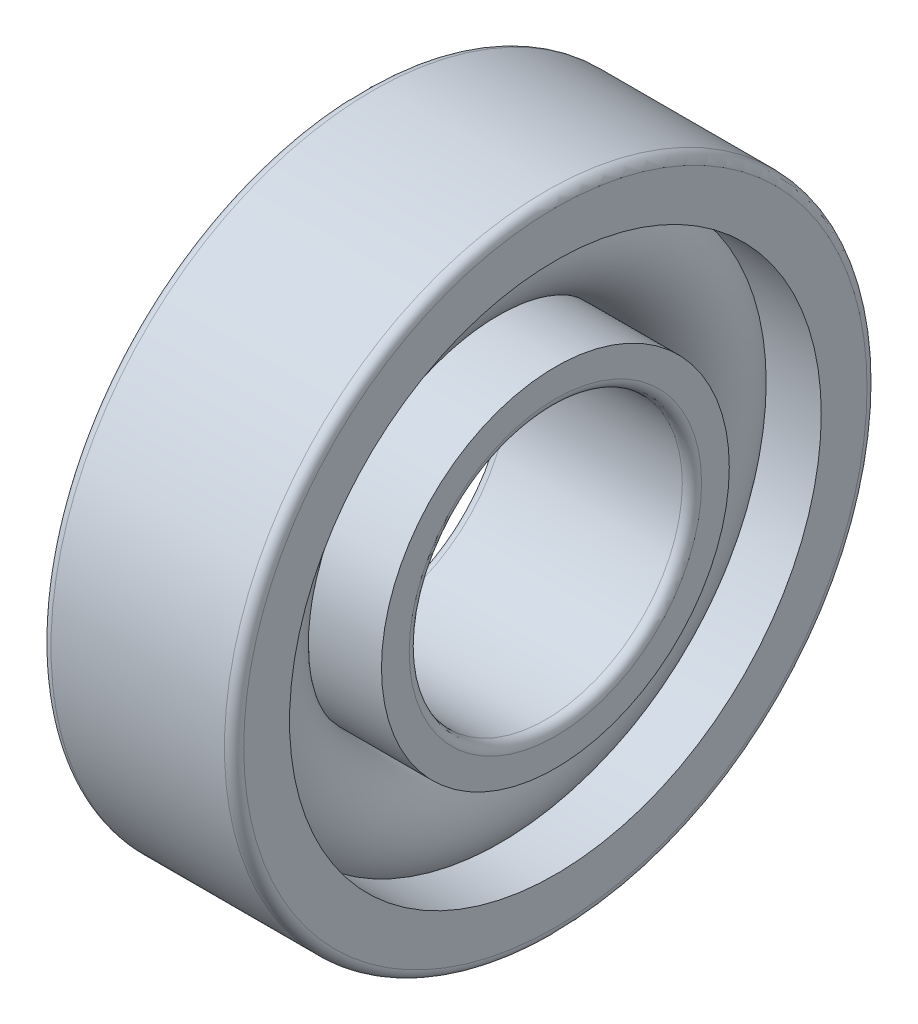
from build123d import *

# Parameters (mm, degrees)
CAGSPISKE_W     = 1.725
CAGSPISKE_H     = 1.15
CAGESPINE_ANGLE = 0.001
BALSIMSKE_R     = 3.45


with BuildPart() as part:
    # CagSpiSke → CageSpine (revolve)
    with BuildSketch(Plane.XY):
        with Locations((0, 14.25)):
            Rectangle(CAGSPISKE_W, CAGSPISKE_H)
    revolve(axis=Axis((-20.6375, 0, 0), (1, 0, 0)), revolution_arc=CAGESPINE_ANGLE)

    # BalSimSke → BallsSimplified (revolve)
    with BuildSketch(Plane.XY):
        with Locations((0, 14.25)):
            Circle(BALSIMSKE_R)
    revolve(axis=Axis((-10, 0, 0), (1, 0, 0)))

    # InnRacSke → InnerRace (revolve)
    with BuildSketch(Plane.XY):
        with BuildLine():
            Line((-2.537838647, 11.95), (-6, 11.95))
            Line((-6, 11.95), (-6, 9.1))
            ThreePointArc((-6, 9.1), (-5.824264069, 8.675735931), (-5.4, 8.5))
            Line((-5.4, 8.5), (5.4, 8.5))
            ThreePointArc((5.4, 8.5), (5.824264069, 8.675735931), (6, 9.1))
            Line((6, 9.1), (6, 10.825))
            Line((6, 10.825), (0, 10.825))
            ThreePointArc((0, 10.825), (-1.388006664, 11.11885604), (-2.537838647, 11.95))
        make_face()
    revolve(axis=Axis((-20.6375, 0, 0), (1, 0, 0)))

    # OutRacSke → OuterRace (revolve)
    with BuildSketch(Plane.XY):
        with BuildLine():
            Line((0, 17.675), (-6, 17.675))
            Line((-6, 17.675), (-6, 19.4))
            ThreePointArc((-6, 19.4), (-5.824264069, 19.824264069), (-5.4, 20))
            Line((-5.4, 20), (5.4, 20))
            ThreePointArc((5.4, 20), (5.824264069, 19.824264069), (6, 19.4))
            Line((6, 19.4), (6, 16.55))
            Line((6, 16.55), (2.537838647, 16.55))
            ThreePointArc((2.537838647, 16.55), (1.388006664, 17.38114396), (0, 17.675))
        make_face()
    revolve(axis=Axis((-20.6375, 0, 0), (1, 0, 0)))


solid = part.part
